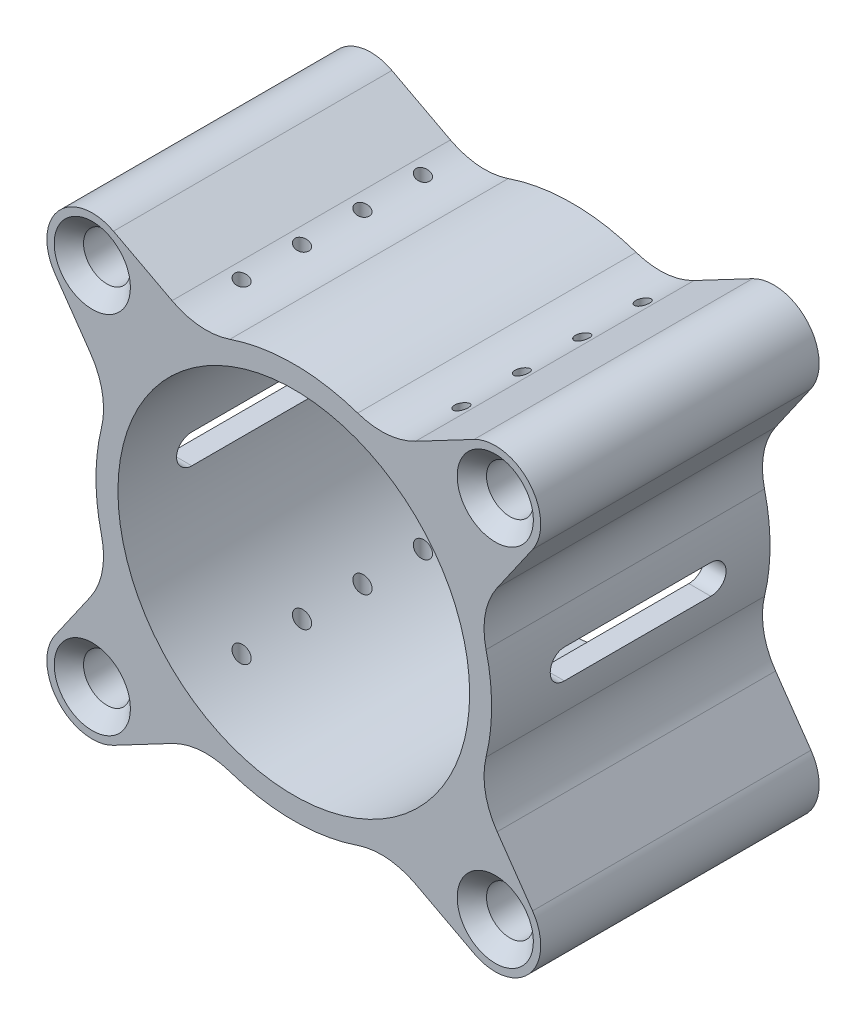
from build123d import *
from OCP.BRepAlgoAPI import BRepAlgoAPI_Cut
from OCP.TopTools import TopTools_ListOfShape

# Parameters (mm, degrees)
SKETCH1_W           = 292.1
SKETCH1_H           = 89.8
SKETCH1_R           = 14.2875
SKETCH1_R_2         = 2.54
SKETCH1_R_3         = 17.145
BOSS_EXTRUDE1_DEPTH = 6.35
SKETCH2_R           = 2.05
CUT_EXTRUDE1_DEPTH  = 10
SKETCH3_R           = 1.55
SKETCH3_R_2         = 2.05
SKETCH3_R_3         = 1.5
CUT_EXTRUDE2_DEPTH  = 10
FILLET1_R           = 2
SKETCH4_R           = 2.05
SKETCH4_R_2         = 1.778
CUT_EXTRUDE4_DEPTH  = 306.657933808
SKETCH5_R           = 3.2
SKETCH5_R_2         = 24
SKETCH5_R_3         = 6.2
BOSS_EXTRUDE2_DEPTH = 38
SKETCH6_W           = 320.608032734
SKETCH6_H           = 6.35
CUT_EXTRUDE5_DEPTH  = 309.793413952
SKETCH7_R           = 0.925
CUT_EXTRUDE7_DEPTH  = 201.132418663
FILLET2_R           = 10
CHAMFER1_SIZE       = 2
CUT_EXTRUDE8_START  = 119.05
CUT_EXTRUDE8_DEPTH  = 53.999999125
SCALE1_SCALE        = 0.333333333


with BuildPart() as part:
    # Sketch1 → Boss-Extrude1 (new body)
    with BuildSketch(Plane.XY):
        with Locations((146.05, 44.9)):
            Rectangle(SKETCH1_W, SKETCH1_H)
        with Locations((146.05, 44.9)):
            Circle(SKETCH1_R, mode=Mode.SUBTRACT)
        with Locations((103.051585406, 62.859439014)):
            Circle(SKETCH1_R_2, mode=Mode.SUBTRACT)
        with Locations((103.049439014, 26.938414594)):
            Circle(SKETCH1_R_2, mode=Mode.SUBTRACT)
        with Locations((67.128414594, 26.940560986)):
            Circle(SKETCH1_R_2, mode=Mode.SUBTRACT)
        with Locations((67.130560986, 62.861585406)):
            Circle(SKETCH1_R_2, mode=Mode.SUBTRACT)
        with Locations((85.09, 44.9)):
            Circle(SKETCH1_R_3, mode=Mode.SUBTRACT)
        with Locations((189.050560986, 62.861585406)):
            Circle(SKETCH1_R_2, mode=Mode.SUBTRACT)
        with Locations((224.971585406, 62.859439014)):
            Circle(SKETCH1_R_2, mode=Mode.SUBTRACT)
        with Locations((224.969439014, 26.938414594)):
            Circle(SKETCH1_R_2, mode=Mode.SUBTRACT)
        with Locations((189.048414594, 26.940560986)):
            Circle(SKETCH1_R_2, mode=Mode.SUBTRACT)
        with Locations((207.01, 44.9)):
            Circle(SKETCH1_R_3, mode=Mode.SUBTRACT)
    extrude(amount=BOSS_EXTRUDE1_DEPTH)

    # Sketch2 → Cut-Extrude1 (cut)
    with BuildSketch(Plane.XY.offset(6.35)):
        with Locations((118.55, 20)):
            Circle(SKETCH2_R)
        with Locations(Location((118.55, 69.8, 0), (0, 0, 180))):
            Circle(SKETCH2_R)
        with Locations(Location((173.55, 20, 0), (0, 0, 180))):
            Circle(SKETCH2_R)
        with Locations((173.55, 69.8)):
            Circle(SKETCH2_R)
    extrude(amount=-CUT_EXTRUDE1_DEPTH, mode=Mode.SUBTRACT)

    # Sketch3 → Cut-Extrude2 (cut)
    with BuildSketch(Plane.XY.offset(6.35)):
        with Locations((284.6, 7.5)):
            Circle(SKETCH3_R)
        with Locations(Location((7.5, 7.5, 0), (0, 0, 180))):
            Circle(SKETCH3_R)
        with Locations((7.5, 82.3)):
            Circle(SKETCH3_R)
        with Locations(Location((284.6, 82.3, 0), (0, 0, 180))):
            Circle(SKETCH3_R)
        with Locations((274.6, 20)):
            Circle(SKETCH3_R_2)
        with Locations(Location((17.5, 20, 0), (0, 0, 180))):
            Circle(SKETCH3_R_2)
        with Locations((17.5, 69.8)):
            Circle(SKETCH3_R_2)
        with Locations(Location((274.6, 69.8, 0), (0, 0, 180))):
            Circle(SKETCH3_R_2)
        with Locations((173.55, 7.5)):
            Circle(SKETCH3_R_3)
        with Locations((173.55, 82.3)):
            Circle(SKETCH3_R_3)
        with Locations((118.55, 82.3)):
            Circle(SKETCH3_R_3)
        with Locations((118.55, 7.5)):
            Circle(SKETCH3_R_3)
    extrude(amount=-CUT_EXTRUDE2_DEPTH, mode=Mode.SUBTRACT)

    # Fillet1
    fillet1_edges = [part.edges().sort_by_distance(p)[0] for p in [
        (0, 89.8, 3.175),
        (292.1, 89.8, 3.175),
        (292.1, 0, 3.175),
        (0, 0, 3.175),
    ]]
    fillet(fillet1_edges, radius=FILLET1_R)

    # Sketch4 → Cut-Extrude4 (cut, through all)
    with BuildSketch(Plane.XY.offset(6.35)):
        with Locations((233.55, 20)):
            Circle(SKETCH4_R)
        with Locations((233.55, 69.8)):
            Circle(SKETCH4_R_2)
        with Locations((58.55, 69.8)):
            Circle(SKETCH4_R_2)
        with Locations((58.55, 20)):
            Circle(SKETCH4_R_2)
    extrude(amount=-CUT_EXTRUDE4_DEPTH, mode=Mode.SUBTRACT)

    # Sketch5 → Boss-Extrude2 (add)
    # profile 1 of 3: a face of its own
    with BuildSketch(Plane.XY.offset(6.35)):
        with BuildLine():
            ThreePointArc((158.487656198, 68.864655397), (146.05, 71.9), (133.612343802, 68.864655397))
            Line((133.612343802, 68.864655397), (121.442598426, 75.283874027))
            ThreePointArc((121.442598426, 75.283874027), (113.905359667, 73.90698383), (113.461443019, 66.257883705))
            Line((113.461443019, 66.257883705), (121.116803512, 55.260295021))
            ThreePointArc((121.116803512, 55.260295021), (119.05, 44.9), (121.116803512, 34.539704979))
            Line((121.116803512, 34.539704979), (113.461443019, 23.542116295))
            ThreePointArc((113.461443019, 23.542116295), (113.905359667, 15.89301617), (121.442598426, 14.516125973))
            Line((121.442598426, 14.516125973), (133.612343802, 20.935344603))
            ThreePointArc((133.612343802, 20.935344603), (146.05, 17.9), (158.487656198, 20.935344603))
            Line((158.487656198, 20.935344603), (170.657401574, 14.516125973))
            ThreePointArc((170.657401574, 14.516125973), (168.905359667, 24.10698383), (178.638556981, 23.542116295))
            Line((178.638556981, 23.542116295), (170.983196488, 34.539704979))
            ThreePointArc((170.983196488, 34.539704979), (173.05, 44.9), (170.983196488, 55.260295021))
            ThreePointArc((170.983196488, 55.260295021), (165.935039927, 63.16431458), (158.487656198, 68.864655397))
        make_face()
        with Locations((118.55, 20)):
            Circle(SKETCH5_R, mode=Mode.SUBTRACT)
        with Locations((118.55, 69.8)):
            Circle(SKETCH5_R, mode=Mode.SUBTRACT)
        with Locations((146.05, 44.9)):
            Circle(SKETCH5_R_2, mode=Mode.SUBTRACT)
    # profile 2 of 3: a face of its own
    with BuildSketch(Plane.XY.offset(6.35)):
        with BuildLine():
            Line((170.657401574, 75.283874027), (158.487656198, 68.864655397))
            ThreePointArc((158.487656198, 68.864655397), (165.935039927, 63.16431458), (170.983196488, 55.260295021))
            Line((170.983196488, 55.260295021), (178.638556981, 66.257883705))
            ThreePointArc((178.638556981, 66.257883705), (178.194640333, 73.90698383), (170.657401574, 75.283874027))
        make_face()
        with Locations((173.55, 69.8)):
            Circle(SKETCH5_R, mode=Mode.SUBTRACT)
    # profile 3 of 3: a face of its own
    with BuildSketch(Plane.XY.offset(6.35)):
        with Locations((173.55, 20)):
            Circle(SKETCH5_R_3)
        with Locations((173.55, 20)):
            Circle(SKETCH5_R, mode=Mode.SUBTRACT)
    extrude(amount=BOSS_EXTRUDE2_DEPTH)

    # Sketch6 → Cut-Extrude5 (cut, through all)
    with BuildSketch(Plane(origin=(0, 89.8, 0), x_dir=(1, 0, 0), z_dir=(0, 1, 0))):
        with Locations((145.848635184, -3.175)):
            Rectangle(SKETCH6_W, SKETCH6_H)
    extrude(amount=-CUT_EXTRUDE5_DEPTH, mode=Mode.SUBTRACT)

    # Sketch7 → Cut-Extrude7 (cut, through all)
    with BuildSketch(Plane(origin=(0, 0, 0), x_dir=(1, 0, 0), z_dir=(0, 1, 0))):
        with Locations(Location((161.05, -11.725, 0), (0, 0, 90))):
            Circle(SKETCH7_R)
        with Locations(Location((161.05, -19.975, 0), (0, 0, 90))):
            Circle(SKETCH7_R)
        with Locations(Location((161.05, -28.225, 0), (0, 0, 90))):
            Circle(SKETCH7_R)
        with Locations(Location((161.05, -36.475, 0), (0, 0, 90))):
            Circle(SKETCH7_R)
        with Locations(Location((131.05, -36.475, 0), (0, 0, 90))):
            Circle(SKETCH7_R)
        with Locations(Location((131.05, -28.225, 0), (0, 0, 90))):
            Circle(SKETCH7_R)
        with Locations(Location((131.05, -19.975, 0), (0, 0, 90))):
            Circle(SKETCH7_R)
        with Locations(Location((131.05, -11.725, 0), (0, 0, 90))):
            Circle(SKETCH7_R)
    extrude(amount=CUT_EXTRUDE7_DEPTH, mode=Mode.SUBTRACT)

    # Fillet2
    # the kernel refuses this fillet: 10 mm, written as the material it adds along each edge
    with BuildSketch(Plane(origin=(121.116803512, 55.260295021, 6.35), x_dir=(-0.3103874133456738, -0.9506101480820525, 0), z_dir=(0, 0, 1))) as fillet2_piece_1:
        with BuildLine():
            CenterArc((5.000654742, -9.969427696), FILLET2_R, 94.481386739, 48.442755032)
            Line((-2.977725475, -3.940709001), (0, 0))
            ThreePointArc((0, 0), (2.109651219, -0.082545222), (4.219302439, 0))
        make_face()
    extrude(amount=38)
    with BuildSketch(Plane(origin=(121.116803512, 34.539704979, 6.35), x_dir=(-0.571309079849458, -0.8207349969884101, 0), z_dir=(0, 0, 1)), Plane(origin=(170.983196488, 55.260295021, 6.35), x_dir=(0.5713090798494619, 0.8207349969884075, 0), z_dir=(0, 0, 1))) as fillet2_piece_2:
        with BuildLine():
            CenterArc((4.939234397, -10), FILLET2_R, 90, 48.442755032)
            ThreePointArc((-2.543698749, -3.366319911), (-1.205991658, -1.732924148), (0, 0))
            Line((0, 0), (4.939234397, 0))
        make_face()
    extrude(amount=38)
    with BuildSketch(Plane(origin=(133.612343802, 20.935344603, 6.35), x_dir=(0.9195498478391192, -0.39297337993692766, 0), z_dir=(0, 0, 1))) as fillet2_piece_3_section:
        with BuildLine():
            CenterArc((4.787136553, -9.971986303), FILLET2_R, 94.28967391, 46.660425518)
            Line((-2.978839179, -3.672016389), (0, 0))
            ThreePointArc((0, 0), (2.019573233, -0.075636981), (4.039146467, 0))
        make_face()
    fillet2_piece_3 = extrude(amount=38, mode=Mode.PRIVATE)
    fillet2_piece_3 = fillet2_piece_3 - Plane(origin=(131.05, 20.935344603, 36.475), x_dir=(0, 0, -1), z_dir=(0, -1, 0)) * Cylinder(0.925, 93, mode=Mode.PRIVATE)
    fillet2_piece_3 = fillet2_piece_3 - Plane(origin=(131.05, 20.935344603, 28.225), x_dir=(0, 0, -1), z_dir=(0, -1, 0)) * Cylinder(0.925, 93, mode=Mode.PRIVATE)
    fillet2_piece_3 = fillet2_piece_3 - Plane(origin=(131.05, 20.935344603, 19.975), x_dir=(0, 0, -1), z_dir=(0, -1, 0)) * Cylinder(0.925, 93, mode=Mode.PRIVATE)
    fillet2_piece_3 = fillet2_piece_3 - Plane(origin=(131.05, 20.935344603, 11.725), x_dir=(0, 0, -1), z_dir=(0, -1, 0)) * Cylinder(0.925, 93, mode=Mode.PRIVATE)
    add(fillet2_piece_3)
    with BuildSketch(Plane(origin=(158.487656198, 20.935344603, 6.35), x_dir=(0.8844958108424843, -0.46654813321038596, 0), z_dir=(0, 0, 1))) as fillet2_piece_4_section:
        with BuildLine():
            CenterArc((4.728338737, -10), FILLET2_R, 90, 46.660425518)
            ThreePointArc((-2.544650122, -3.136791344), (-1.213585565, -1.616046743), (0, 0))
            Line((0, 0), (4.728338737, 0))
        make_face()
    fillet2_piece_4 = extrude(amount=38, mode=Mode.PRIVATE)
    fillet2_piece_4 = fillet2_piece_4 - Plane(origin=(161.05, 20.935344603, 36.475), x_dir=(0, 0, -1), z_dir=(0, -1, 0)) * Cylinder(0.925, 95, mode=Mode.PRIVATE)
    fillet2_piece_4 = fillet2_piece_4 - Plane(origin=(161.05, 20.935344603, 28.225), x_dir=(0, 0, -1), z_dir=(0, -1, 0)) * Cylinder(0.925, 95, mode=Mode.PRIVATE)
    fillet2_piece_4 = fillet2_piece_4 - Plane(origin=(161.05, 20.935344603, 19.975), x_dir=(0, 0, -1), z_dir=(0, -1, 0)) * Cylinder(0.925, 95, mode=Mode.PRIVATE)
    fillet2_piece_4 = fillet2_piece_4 - Plane(origin=(161.05, 20.935344603, 11.725), x_dir=(0, 0, -1), z_dir=(0, -1, 0)) * Cylinder(0.925, 95, mode=Mode.PRIVATE)
    add(fillet2_piece_4)
    with BuildSketch(Plane(origin=(170.983196488, 34.539704979, 6.35), x_dir=(0.5713090798494577, -0.8207349969884103, 0), z_dir=(0, 0, 1))) as fillet2_piece_5:
        with BuildLine():
            CenterArc((4.939234397, 10), FILLET2_R, 221.557244968, 48.442755032)
            ThreePointArc((-2.543698749, 3.366319911), (-1.205991658, 1.732924148), (0, 0))
            Line((0, 0), (4.939234397, 0))
        make_face()
    extrude(amount=38)
    with BuildSketch(Plane(origin=(158.487656198, 68.864655397, 6.35), x_dir=(-0.9195498478391212, 0.3929733799369225, 0), z_dir=(0, 0, 1))) as fillet2_piece_6_section:
        with BuildLine():
            CenterArc((4.787136553, -9.971986303), FILLET2_R, 94.28967391, 46.660425518)
            Line((-2.978839179, -3.672016389), (0, 0))
            ThreePointArc((0, 0), (2.019573233, -0.075636981), (4.039146467, 0))
        make_face()
    fillet2_piece_6 = extrude(amount=38, mode=Mode.PRIVATE)
    fillet2_piece_6 = fillet2_piece_6 - Plane(origin=(161.05, 68.864655397, 36.475), x_dir=(0, 0, -1), z_dir=(0, -1, 0)) * Cylinder(0.925, 93, mode=Mode.PRIVATE)
    fillet2_piece_6 = fillet2_piece_6 - Plane(origin=(161.05, 68.864655397, 28.225), x_dir=(0, 0, -1), z_dir=(0, -1, 0)) * Cylinder(0.925, 93, mode=Mode.PRIVATE)
    fillet2_piece_6 = fillet2_piece_6 - Plane(origin=(161.05, 68.864655397, 19.975), x_dir=(0, 0, -1), z_dir=(0, -1, 0)) * Cylinder(0.925, 93, mode=Mode.PRIVATE)
    fillet2_piece_6 = fillet2_piece_6 - Plane(origin=(161.05, 68.864655397, 11.725), x_dir=(0, 0, -1), z_dir=(0, -1, 0)) * Cylinder(0.925, 93, mode=Mode.PRIVATE)
    add(fillet2_piece_6)
    with BuildSketch(Plane(origin=(133.612343802, 68.864655397, 6.35), x_dir=(-0.8844958108424825, 0.46654813321038935, 0), z_dir=(0, 0, 1))) as fillet2_piece_7_section:
        with BuildLine():
            CenterArc((4.728338737, -10), FILLET2_R, 90, 46.660425518)
            ThreePointArc((-2.544650122, -3.136791344), (-1.213585565, -1.616046743), (0, 0))
            Line((0, 0), (4.728338737, 0))
        make_face()
    fillet2_piece_7 = extrude(amount=38, mode=Mode.PRIVATE)
    fillet2_piece_7 = fillet2_piece_7 - Plane(origin=(131.05, 68.864655397, 36.475), x_dir=(0, 0, -1), z_dir=(0, -1, 0)) * Cylinder(0.925, 95, mode=Mode.PRIVATE)
    fillet2_piece_7 = fillet2_piece_7 - Plane(origin=(131.05, 68.864655397, 28.225), x_dir=(0, 0, -1), z_dir=(0, -1, 0)) * Cylinder(0.925, 95, mode=Mode.PRIVATE)
    fillet2_piece_7 = fillet2_piece_7 - Plane(origin=(131.05, 68.864655397, 19.975), x_dir=(0, 0, -1), z_dir=(0, -1, 0)) * Cylinder(0.925, 95, mode=Mode.PRIVATE)
    fillet2_piece_7 = fillet2_piece_7 - Plane(origin=(131.05, 68.864655397, 11.725), x_dir=(0, 0, -1), z_dir=(0, -1, 0)) * Cylinder(0.925, 95, mode=Mode.PRIVATE)
    add(fillet2_piece_7)

    # Chamfer1
    chamfer1_edges = [part.edges().sort_by_distance(p)[0] for p in [
        (170.35, 69.8, 44.35),
        (115.35, 69.8, 44.35),
        (115.35, 20, 44.35),
        (170.35, 20, 44.35),
    ]]
    chamfer(chamfer1_edges, length=CHAMFER1_SIZE)


with BuildPart() as cut_extrude8_tool:
    # Cut-Extrude8: read off the stored shape, not the designer's step
    # Cut-Extrude8 outline → Cut-Extrude8 (new body)
    with BuildSketch(Plane.YZ.offset(CUT_EXTRUDE8_START)):
        with BuildLine():
            Line((46.9, 14.35), (46.9, 34.35))
            ThreePointArc((46.9, 34.35), (44.9, 36.35), (42.9, 34.35))
            Line((42.9, 34.35), (42.9, 14.35))
            ThreePointArc((42.9, 14.35), (44.9, 12.35), (46.9, 14.35))
        make_face()
    extrude(amount=CUT_EXTRUDE8_DEPTH)


with BuildPart() as part_1:
    add(part.part)

    # Cut-Extrude8: cut by cut_extrude8_tool, with a tolerance
    cut_extrude8_stock = TopTools_ListOfShape()
    cut_extrude8_stock.Append(part_1.part.wrapped)
    cut_extrude8_tools = TopTools_ListOfShape()
    cut_extrude8_tools.Append(cut_extrude8_tool.part.wrapped)
    cut_extrude8_cut = BRepAlgoAPI_Cut()
    cut_extrude8_cut.SetArguments(cut_extrude8_stock)
    cut_extrude8_cut.SetTools(cut_extrude8_tools)
    cut_extrude8_cut.SetFuzzyValue(0.00001)
    cut_extrude8_cut.Build()
    add(Compound.cast(cut_extrude8_cut.Shape()).solids(), mode=Mode.REPLACE)


with BuildPart() as part_2:
    # Scale1: scaled about (146.050008742, 44.900008572, 25.29390394)
    add(part_1.part.scale(SCALE1_SCALE).moved(Location((97.366672495, 29.933339048, 16.862602627))))


solid = part_2.part
